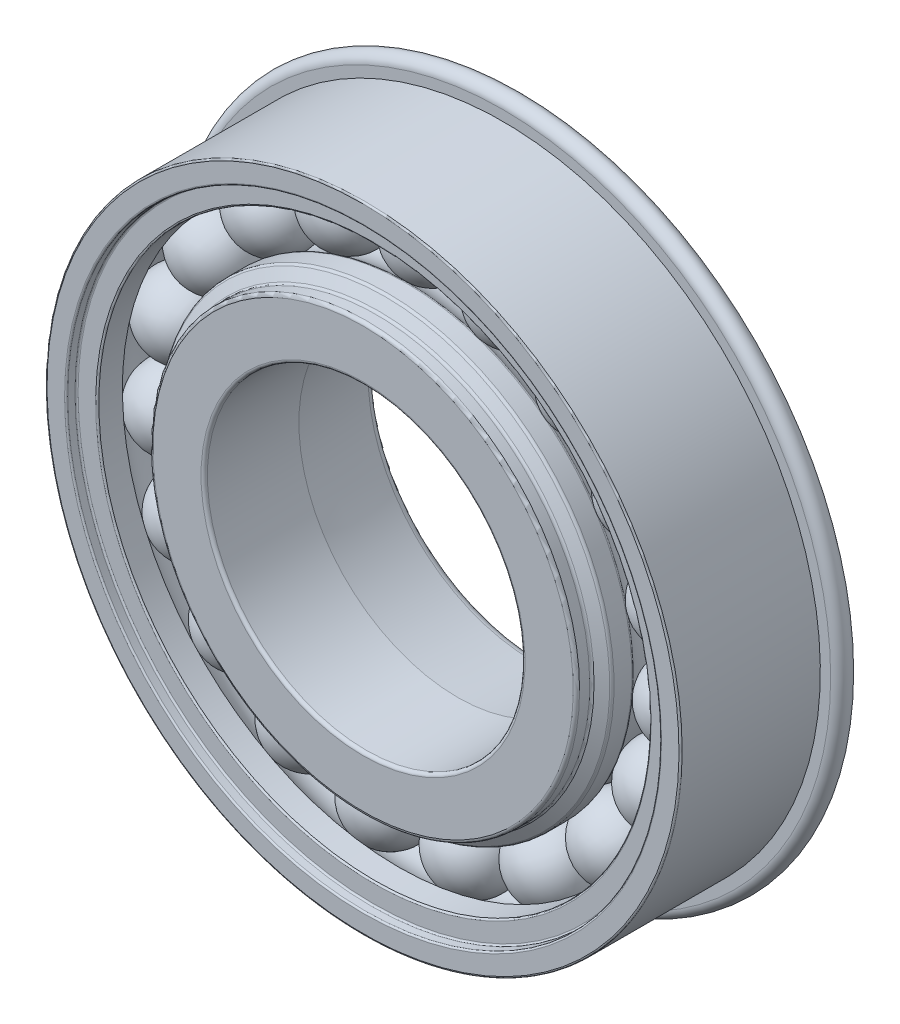
from build123d import *

# Parameters (mm, degrees)
FILLET4_R          = 0.762
CIRPATTERN3_COUNT  = 19
FILLET2_R          = 0.127
FILLET3_R          = 0.127
FILLET5_R          = 0.254
SKETCH12_R         = 24.1554
SKETCH12_R_2       = 22.0853
CUT_EXTRUDE1_DEPTH = 1.143


with BuildPart() as part:
    # Sketch2 → Revolve1 (revolve)
    with BuildSketch(Plane(origin=(0, 0, 0), x_dir=(0, 0, -1), z_dir=(1, 0, 0)), mode=Mode.PRIVATE) as revolve1_sk:
        with BuildLine():
            Line((4.0259, 25.4), (-7.1501, 25.4))
            Line((-7.1501, 25.4), (-7.1501, 23.74265))
            Line((-7.1501, 23.74265), (-6.321425, 23.74265))
            Line((-6.321425, 23.74265), (-6.321425, 22.0853))
            Line((-6.321425, 22.0853), (-4.311730657, 22.0853))
            ThreePointArc((-4.311730657, 22.0853), (-1.5621, 23.6728), (1.187530657, 22.0853))
            Line((1.187530657, 22.0853), (5.5499, 22.0853))
            Line((5.5499, 22.0853), (5.5499, 26.2255))
            ThreePointArc((5.5499, 26.2255), (4.7879, 26.9875), (4.0259, 26.2255))
            Line((4.0259, 26.2255), (4.0259, 25.4))
        make_face()
    revolve(revolve1_sk.sketch.rotate(Axis((0, 0, 7.1501), (0, 0, -1)), 180), axis=Axis((0, 0, 7.1501), (0, 0, -1)))

    # Fillet2
    fillet2_edges = [part.edges().sort_by_distance(p)[0] for p in [
        (0, 22.0853, 6.321425),
        (0, 23.74265, 6.321425),
    ]]
    fillet(fillet2_edges, radius=FILLET2_R)

    # Fillet3
    fillet3_edges = [part.edges().sort_by_distance(p)[0] for p in [
        (0, 23.74265, 7.1501),
        (0, 25.4, 7.1501),
    ]]
    fillet(fillet3_edges, radius=FILLET3_R)

    # Sketch12 → Cut-Extrude1 (cut)
    with BuildSketch(Plane(origin=(0, 0, -5.5499), x_dir=(-1, 0, 0), z_dir=(0, 0, -1))):
        with Locations(Location((0, 0, 0), (0, 0, 90))):
            Circle(SKETCH12_R)
        with Locations(Location((0, 0, 0), (0, 0, 270))):
            Circle(SKETCH12_R_2, mode=Mode.SUBTRACT)
    extrude(amount=-CUT_EXTRUDE1_DEPTH, mode=Mode.SUBTRACT)


with BuildPart() as body_2:
    # Sketch3 → Revolve2 (revolve)
    with BuildSketch(Plane(origin=(0, 0, 0), x_dir=(0, 0, -1), z_dir=(1, 0, 0)), mode=Mode.PRIVATE) as revolve2_sk:
        with BuildLine():
            Line((-7.1501, 17.0688), (-5.940262511, 17.0688))
            Line((-5.940262511, 17.0688), (-5.335343766, 18.11655))
            Line((-5.335343766, 18.11655), (-3.662165103, 18.11655))
            ThreePointArc((-3.662165103, 18.11655), (-1.5621, 17.3228), (0.537965103, 18.11655))
            Line((0.537965103, 18.11655), (3.420981255, 18.11655))
            Line((3.420981255, 18.11655), (4.0259, 17.0688))
            Line((4.0259, 17.0688), (7.1501, 17.0688))
            Line((7.1501, 17.0688), (7.1501, 12.7))
            Line((7.1501, 12.7), (-7.1501, 12.7))
            Line((-7.1501, 12.7), (-7.1501, 17.0688))
        make_face()
    revolve(revolve2_sk.sketch.rotate(Axis((0, 0, 7.1501), (0, 0, -1)), 180), axis=Axis((0, 0, 7.1501), (0, 0, -1)))

    # Sketch5 → Cut-Revolve2 (revolve, cut)
    with BuildSketch(Plane(origin=(0, 0, 0), x_dir=(0, 0, -1), z_dir=(1, 0, 0)), mode=Mode.PRIVATE) as cut_revolve2_sk:
        with BuildLine():
            Line((7.1501, 13.7922), (7.1501, 12.7))
            Line((7.1501, 12.7), (0.418894689, 12.7))
            Line((0.418894689, 12.7), (6.480477196, 13.230319752))
            ThreePointArc((6.480477196, 13.230319752), (6.903868679, 13.405694247), (7.1501, 13.7922))
        make_face()
    revolve(cut_revolve2_sk.sketch.rotate(Axis((0, 0, 7.1501), (0, 0, -1)), 180), axis=Axis((0, 0, 7.1501), (0, 0, -1)), mode=Mode.SUBTRACT)

    # Sketch6 → Cut-Revolve3 (revolve, cut)
    with BuildSketch(Plane(origin=(0, 0, 0), x_dir=(0, 0, -1), z_dir=(1, 0, 0)), mode=Mode.PRIVATE) as cut_revolve3_sk:
        with BuildLine():
            Line((6.90475484, 13.857940037), (7.1501, 13.7922))
            Line((7.1501, 13.7922), (7.1501, 13.890810056))
            Line((7.1501, 13.890810056), (6.78208226, 13.890810056))
            ThreePointArc((6.78208226, 13.890810056), (6.6589666, 13.69755718), (6.447270858, 13.609869932))
            Line((6.447270858, 13.609869932), (5.5499, 13.531360155))
            Line((5.5499, 13.531360155), (5.5499, 13.403875036))
            Line((5.5499, 13.403875036), (6.458339638, 13.483353206))
            ThreePointArc((6.458339638, 13.483353206), (6.740600626, 13.600269535), (6.90475484, 13.857940037))
        make_face()
    revolve(cut_revolve3_sk.sketch.rotate(Axis((0, 0, 7.1501), (0, 0, -1)), 180), axis=Axis((0, 0, 7.1501), (0, 0, -1)), mode=Mode.SUBTRACT)

    # Fillet4
    # the kernel refuses this fillet: 0.762 mm, written as the material it takes off along each edge
    with BuildSketch(Plane(origin=(0, 0, -7.1501), x_dir=(0, -1, 0), z_dir=(1, 0, 0))) as fillet4_piece_1:
        with BuildLine():
            CenterArc((14.543053859, -0.762), FILLET4_R, 90, 58.866285833)
            Line((13.890810056, -0.36801774), (13.87776518, -0.360138095))
            ThreePointArc((13.87776518, -0.360138095), (13.875570056, -0.18400887), (13.875570056, 0))
            Line((13.875570056, 0), (13.890810056, 0.01524))
            Line((13.890810056, 0.01524), (14.543053859, 0.01524))
            Line((14.543053859, 0.01524), (14.543053859, 0))
        make_face()
    revolve(axis=Axis((0, 0, -7.1501), (0, 0, -1)), mode=Mode.SUBTRACT)

    # Sketch7 → Cut-Revolve4 (revolve, cut)
    with BuildSketch(Plane(origin=(0, 0, 0), x_dir=(0, 0, -1), z_dir=(1, 0, 0)), mode=Mode.PRIVATE) as cut_revolve4_sk:
        Polygon((7.1501, 15.9766), (7.1501, 17.0688), (6.786033333, 17.0688), (6.786033333, 16.704733333), (6.786033333, 16.340666667), (6.786033333, 15.9766), align=None)
    revolve(cut_revolve4_sk.sketch.rotate(Axis((0, 0, 7.1501), (0, 0, -1)), 180), axis=Axis((0, 0, 7.1501), (0, 0, -1)), mode=Mode.SUBTRACT)

    # Fillet5
    fillet5_edges = [body_2.edges().sort_by_distance(p)[0] for p in [
        (0, 12.7, 7.1501),
        (0, 15.9766, -7.1501),
        (0, 17.0688, -6.786033333),
        (0, 17.0688, 7.1501),
        (0, 17.0688, 5.940262511),
        (0, 18.11655, 5.335343766),
        (0, 18.11655, 3.662165103),
        (0, 18.11655, -0.537965103),
        (0, 17.0688, -4.0259),
    ]]
    fillet(fillet5_edges, radius=FILLET5_R)


with BuildPart() as body_3:
    # Sketch11 → Revolve3 (revolve)
    with BuildSketch(Plane(origin=(0, 0, 0), x_dir=(0, 0, -1), z_dir=(1, 0, 0))):
        with BuildLine():
            Line((-1.5621, 23.6728), (-1.5621, 17.3228))
            ThreePointArc((-1.5621, 17.3228), (1.6129, 20.4978), (-1.5621, 23.6728))
        make_face()
    revolve(axis=Axis((0, 23.6728, 1.5621), (0, -1, 0)))


with BuildPart() as cirpattern3_1:
    # CirPattern3: pattern copy
    add(body_3.part.rotate(Axis((0, 0, 0), (0, 0, 1)), 1 * 360 / CIRPATTERN3_COUNT))


with BuildPart() as cirpattern3_2:
    # CirPattern3: pattern copy
    add(body_3.part.rotate(Axis((0, 0, 0), (0, 0, 1)), 2 * 360 / CIRPATTERN3_COUNT))


with BuildPart() as cirpattern3_3:
    # CirPattern3: pattern copy
    add(body_3.part.rotate(Axis((0, 0, 0), (0, 0, 1)), 3 * 360 / CIRPATTERN3_COUNT))


with BuildPart() as cirpattern3_4:
    # CirPattern3: pattern copy
    add(body_3.part.rotate(Axis((0, 0, 0), (0, 0, 1)), 4 * 360 / CIRPATTERN3_COUNT))


with BuildPart() as cirpattern3_5:
    # CirPattern3: pattern copy
    add(body_3.part.rotate(Axis((0, 0, 0), (0, 0, 1)), 5 * 360 / CIRPATTERN3_COUNT))


with BuildPart() as cirpattern3_6:
    # CirPattern3: pattern copy
    add(body_3.part.rotate(Axis((0, 0, 0), (0, 0, 1)), 6 * 360 / CIRPATTERN3_COUNT))


with BuildPart() as cirpattern3_7:
    # CirPattern3: pattern copy
    add(body_3.part.rotate(Axis((0, 0, 0), (0, 0, 1)), 7 * 360 / CIRPATTERN3_COUNT))


with BuildPart() as cirpattern3_8:
    # CirPattern3: pattern copy
    add(body_3.part.rotate(Axis((0, 0, 0), (0, 0, 1)), 8 * 360 / CIRPATTERN3_COUNT))


with BuildPart() as cirpattern3_9:
    # CirPattern3: pattern copy
    add(body_3.part.rotate(Axis((0, 0, 0), (0, 0, 1)), 9 * 360 / CIRPATTERN3_COUNT))


with BuildPart() as cirpattern3_10:
    # CirPattern3: pattern copy
    add(body_3.part.rotate(Axis((0, 0, 0), (0, 0, 1)), 10 * 360 / CIRPATTERN3_COUNT))


with BuildPart() as cirpattern3_11:
    # CirPattern3: pattern copy
    add(body_3.part.rotate(Axis((0, 0, 0), (0, 0, 1)), 11 * 360 / CIRPATTERN3_COUNT))


with BuildPart() as cirpattern3_12:
    # CirPattern3: pattern copy
    add(body_3.part.rotate(Axis((0, 0, 0), (0, 0, 1)), 12 * 360 / CIRPATTERN3_COUNT))


with BuildPart() as cirpattern3_13:
    # CirPattern3: pattern copy
    add(body_3.part.rotate(Axis((0, 0, 0), (0, 0, 1)), 13 * 360 / CIRPATTERN3_COUNT))


with BuildPart() as cirpattern3_14:
    # CirPattern3: pattern copy
    add(body_3.part.rotate(Axis((0, 0, 0), (0, 0, 1)), 14 * 360 / CIRPATTERN3_COUNT))


with BuildPart() as cirpattern3_15:
    # CirPattern3: pattern copy
    add(body_3.part.rotate(Axis((0, 0, 0), (0, 0, 1)), 15 * 360 / CIRPATTERN3_COUNT))


with BuildPart() as cirpattern3_16:
    # CirPattern3: pattern copy
    add(body_3.part.rotate(Axis((0, 0, 0), (0, 0, 1)), 16 * 360 / CIRPATTERN3_COUNT))


with BuildPart() as cirpattern3_17:
    # CirPattern3: pattern copy
    add(body_3.part.rotate(Axis((0, 0, 0), (0, 0, 1)), 17 * 360 / CIRPATTERN3_COUNT))


with BuildPart() as cirpattern3_18:
    # CirPattern3: pattern copy
    add(body_3.part.rotate(Axis((0, 0, 0), (0, 0, 1)), 18 * 360 / CIRPATTERN3_COUNT))


solid = Compound([part.part, body_2.part, body_3.part, cirpattern3_1.part, cirpattern3_2.part, cirpattern3_3.part, cirpattern3_4.part, cirpattern3_5.part, cirpattern3_6.part, cirpattern3_7.part, cirpattern3_8.part, cirpattern3_9.part, cirpattern3_10.part, cirpattern3_11.part, cirpattern3_12.part, cirpattern3_13.part, cirpattern3_14.part, cirpattern3_15.part, cirpattern3_16.part, cirpattern3_17.part, cirpattern3_18.part])
